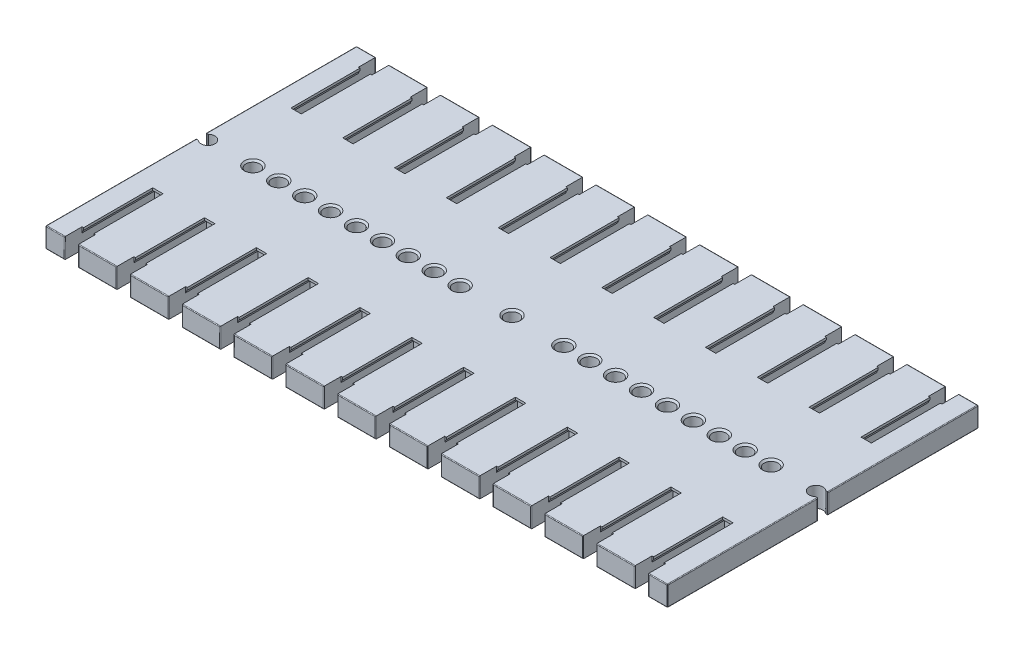
from build123d import *

# Parameters (mm, degrees)
SKETCH_1_W                         = 180
SKETCH_1_H                         = 90
EXTRUDE_1_DEPTH                    = 5.8
CUT_EXTRUDE_1_DEPTH                = 26
SKETCH_3_W                         = 3
SKETCH_3_H                         = 0.677124344
EXTRUDE_2_DEPTH                    = 1
SKETCH_4_W                         = 3.9
SKETCH_4_H                         = 5.8
CUT_EXTRUDE_2_DEPTH                = 5
PATTERN_LINEAR_4_COUNT             = 12
PATTERN_LINEAR_4_PITCH             = 15
PATTERN_LINEAR_4_COPY_1_DEPTH      = 26
PATTERN_LINEAR_4_COPY_2_DEPTH      = 26
PATTERN_LINEAR_4_COPY_3_DEPTH      = 26
PATTERN_LINEAR_4_COPY_4_DEPTH      = 26
PATTERN_LINEAR_4_COPY_5_DEPTH      = 26
PATTERN_LINEAR_4_COPY_6_DEPTH      = 26
PATTERN_LINEAR_4_COPY_7_DEPTH      = 26
PATTERN_LINEAR_4_COPY_8_DEPTH      = 26
PATTERN_LINEAR_4_COPY_9_DEPTH      = 26
PATTERN_LINEAR_4_COPY_10_DEPTH     = 26
PATTERN_LINEAR_4_COPY_11_DEPTH     = 26
PATTERN_LINEAR_4_COPY_12_SKETCH_W  = 3
PATTERN_LINEAR_4_COPY_12_SKETCH_H  = 0.677124344
PATTERN_LINEAR_4_COPY_12_DEPTH     = 1
PATTERN_LINEAR_4_COPY_13_SKETCH_W  = 3
PATTERN_LINEAR_4_COPY_13_SKETCH_H  = 0.677124344
PATTERN_LINEAR_4_COPY_13_DEPTH     = 1
PATTERN_LINEAR_4_COPY_14_SKETCH_W  = 3
PATTERN_LINEAR_4_COPY_14_SKETCH_H  = 0.677124344
PATTERN_LINEAR_4_COPY_14_DEPTH     = 1
PATTERN_LINEAR_4_COPY_15_SKETCH_W  = 3
PATTERN_LINEAR_4_COPY_15_SKETCH_H  = 0.677124344
PATTERN_LINEAR_4_COPY_15_DEPTH     = 1
PATTERN_LINEAR_4_COPY_16_SKETCH_W  = 3
PATTERN_LINEAR_4_COPY_16_SKETCH_H  = 0.677124344
PATTERN_LINEAR_4_COPY_16_DEPTH     = 1
PATTERN_LINEAR_4_COPY_17_SKETCH_W  = 3
PATTERN_LINEAR_4_COPY_17_SKETCH_H  = 0.677124344
PATTERN_LINEAR_4_COPY_17_DEPTH     = 1
PATTERN_LINEAR_4_COPY_18_SKETCH_W  = 3
PATTERN_LINEAR_4_COPY_18_SKETCH_H  = 0.677124344
PATTERN_LINEAR_4_COPY_18_DEPTH     = 1
PATTERN_LINEAR_4_COPY_19_SKETCH_W  = 3
PATTERN_LINEAR_4_COPY_19_SKETCH_H  = 0.677124344
PATTERN_LINEAR_4_COPY_19_DEPTH     = 1
PATTERN_LINEAR_4_COPY_20_SKETCH_W  = 3
PATTERN_LINEAR_4_COPY_20_SKETCH_H  = 0.677124344
PATTERN_LINEAR_4_COPY_20_DEPTH     = 1
PATTERN_LINEAR_4_COPY_21_SKETCH_W  = 3
PATTERN_LINEAR_4_COPY_21_SKETCH_H  = 0.677124344
PATTERN_LINEAR_4_COPY_21_DEPTH     = 1
PATTERN_LINEAR_4_COPY_22_SKETCH_W  = 3
PATTERN_LINEAR_4_COPY_22_SKETCH_H  = 0.677124344
PATTERN_LINEAR_4_COPY_22_DEPTH     = 1
PATTERN_LINEAR_4_COPY_23_SKETCH_W  = 3.9
PATTERN_LINEAR_4_COPY_23_SKETCH_H  = 5.8
PATTERN_LINEAR_4_COPY_23_DEPTH     = 5
PATTERN_LINEAR_4_COPY_24_SKETCH_W  = 3.9
PATTERN_LINEAR_4_COPY_24_SKETCH_H  = 5.8
PATTERN_LINEAR_4_COPY_24_DEPTH     = 5
PATTERN_LINEAR_4_COPY_25_SKETCH_W  = 3.9
PATTERN_LINEAR_4_COPY_25_SKETCH_H  = 5.8
PATTERN_LINEAR_4_COPY_25_DEPTH     = 5
PATTERN_LINEAR_4_COPY_26_SKETCH_W  = 3.9
PATTERN_LINEAR_4_COPY_26_SKETCH_H  = 5.8
PATTERN_LINEAR_4_COPY_26_DEPTH     = 5
PATTERN_LINEAR_4_COPY_27_SKETCH_W  = 3.9
PATTERN_LINEAR_4_COPY_27_SKETCH_H  = 5.8
PATTERN_LINEAR_4_COPY_27_DEPTH     = 5
PATTERN_LINEAR_4_COPY_28_SKETCH_W  = 3.9
PATTERN_LINEAR_4_COPY_28_SKETCH_H  = 5.8
PATTERN_LINEAR_4_COPY_28_DEPTH     = 5
PATTERN_LINEAR_4_COPY_29_SKETCH_W  = 3.9
PATTERN_LINEAR_4_COPY_29_SKETCH_H  = 5.8
PATTERN_LINEAR_4_COPY_29_DEPTH     = 5
PATTERN_LINEAR_4_COPY_30_SKETCH_W  = 3.9
PATTERN_LINEAR_4_COPY_30_SKETCH_H  = 5.8
PATTERN_LINEAR_4_COPY_30_DEPTH     = 5
PATTERN_LINEAR_4_COPY_31_SKETCH_W  = 3.9
PATTERN_LINEAR_4_COPY_31_SKETCH_H  = 5.8
PATTERN_LINEAR_4_COPY_31_DEPTH     = 5
PATTERN_LINEAR_4_COPY_32_SKETCH_W  = 3.9
PATTERN_LINEAR_4_COPY_32_SKETCH_H  = 5.8
PATTERN_LINEAR_4_COPY_32_DEPTH     = 5
PATTERN_LINEAR_4_COPY_33_SKETCH_W  = 3.9
PATTERN_LINEAR_4_COPY_33_SKETCH_H  = 5.8
PATTERN_LINEAR_4_COPY_33_DEPTH     = 5
CUT_EXTRUDE_3_REACH                = 102.79
SKETCH_6_R                         = 2
CHAMFER_1_SIZE                     = 0.5
PATTERN_LINEAR_5_COUNT             = 11
PATTERN_LINEAR_5_PITCH             = 15
CHAMFER_1_OF_PATTERN_LINEAR_5_SIZE = 0.5
CUT_EXTRUDE_4_REACH                = 102.79
SKETCH_7_R                         = 2
CHAMFER_2_SIZE                     = 0.5
PATTERN_LINEAR_7_COUNT             = 4
PATTERN_LINEAR_7_PITCH             = 15
CHAMFER_2_OF_PATTERN_LINEAR_7_SIZE = 0.5
CUT_EXTRUDE_5_REACH                = 102.79
FILLET_4_R                         = 0.2


# Read off the part's stored shape, not the designer's step: 镜向5
with BuildPart() as part:
    # 草图1 → 凸台-拉伸1 (new body)
    with BuildSketch(Plane(origin=(0, 0, 0), x_dir=(1, 0, 0), z_dir=(0, 1, 0))):
        Rectangle(SKETCH_1_W, SKETCH_1_H)
    extrude(amount=EXTRUDE_1_DEPTH)

    # 草图2 → 切除-拉伸1 (cut)
    with BuildSketch(Plane.XY.offset(45)):
        with BuildLine():
            Line((-81, 5.8), (-84, 5.8))
            Line((-84, 5.8), (-84, 5.122875656))
            ThreePointArc((-84, 5.122875656), (-84.280042303, 4.711838473), (-84.45, 4.244409721))
            Line((-84.45, 4.244409721), (-84.45, 1.555590279))
            ThreePointArc((-84.45, 1.555590279), (-84.280042303, 1.088161527), (-84, 0.677124344))
            Line((-84, 0.677124344), (-84, 0))
            Line((-84, 0), (-81, 0))
            Line((-81, 0), (-81, 0.677124344))
            ThreePointArc((-81, 0.677124344), (-80.719957697, 1.088161527), (-80.55, 1.555590279))
            Line((-80.55, 1.555590279), (-80.55, 4.244409721))
            ThreePointArc((-80.55, 4.244409721), (-80.719957697, 4.711838473), (-81, 5.122875656))
            Line((-81, 5.122875656), (-81, 5.8))
        make_face()
    cut_extrude_1 = extrude(amount=-CUT_EXTRUDE_1_DEPTH, mode=Mode.SUBTRACT)

    # 草图3 → 凸台-拉伸2 (add)
    with BuildSketch(Plane.XY.offset(19)):
        with Locations((-82.5, 5.461437828)):
            Rectangle(SKETCH_3_W, SKETCH_3_H)
        with Locations((-82.5, 0.338562172)):
            Rectangle(SKETCH_3_W, SKETCH_3_H)
    extrude_2 = extrude(amount=EXTRUDE_2_DEPTH)

    # 草图4 → 切除-拉伸2 (cut)
    with BuildSketch(Plane.XY.offset(45)):
        with Locations((-82.5, 2.9)):
            Rectangle(SKETCH_4_W, SKETCH_4_H)
    cut_extrude_2 = extrude(amount=-CUT_EXTRUDE_2_DEPTH, mode=Mode.SUBTRACT)

    # 镜向4: 切除-拉伸1, 凸台-拉伸2, 切除-拉伸2 across plane
    add(cut_extrude_1.mirror(Plane.XY), mode=Mode.SUBTRACT)
    add(extrude_2.mirror(Plane.XY))
    add(cut_extrude_2.mirror(Plane.XY), mode=Mode.SUBTRACT)

    # 阵列(线性)4: 切除-拉伸1, 凸台-拉伸2, 切除-拉伸2 ×12
    with Locations(*[(i * PATTERN_LINEAR_4_PITCH, 0, 0) for i in range(1, PATTERN_LINEAR_4_COUNT)]):
        add(cut_extrude_1, mode=Mode.SUBTRACT)
        add(extrude_2)
        add(cut_extrude_2, mode=Mode.SUBTRACT)

    # 阵列(线性)4 copy 1 sketch → 阵列(线性)4 copy 1 (cut)
    with BuildSketch(Plane(origin=(15, 0, -45), x_dir=(1, 0, 0), z_dir=(0, 0, -1))):
        with BuildLine():
            Line((-81, -5.8), (-84, -5.8))
            Line((-84, -5.8), (-84, -5.122875656))
            ThreePointArc((-84, -5.122875656), (-84.280042303, -4.711838473), (-84.45, -4.244409721))
            Line((-84.45, -4.244409721), (-84.45, -1.555590279))
            ThreePointArc((-84.45, -1.555590279), (-84.280042303, -1.088161527), (-84, -0.677124344))
            Line((-84, -0.677124344), (-84, 0))
            Line((-84, 0), (-81, 0))
            Line((-81, 0), (-81, -0.677124344))
            ThreePointArc((-81, -0.677124344), (-80.719957697, -1.088161527), (-80.55, -1.555590279))
            Line((-80.55, -1.555590279), (-80.55, -4.244409721))
            ThreePointArc((-80.55, -4.244409721), (-80.719957697, -4.711838473), (-81, -5.122875656))
            Line((-81, -5.122875656), (-81, -5.8))
        make_face()
    extrude(amount=-PATTERN_LINEAR_4_COPY_1_DEPTH, mode=Mode.SUBTRACT)

    # 阵列(线性)4 copy 2 sketch → 阵列(线性)4 copy 2 (cut)
    with BuildSketch(Plane(origin=(30, 0, -45), x_dir=(1, 0, 0), z_dir=(0, 0, -1))):
        with BuildLine():
            Line((-81, -5.8), (-84, -5.8))
            Line((-84, -5.8), (-84, -5.122875656))
            ThreePointArc((-84, -5.122875656), (-84.280042303, -4.711838473), (-84.45, -4.244409721))
            Line((-84.45, -4.244409721), (-84.45, -1.555590279))
            ThreePointArc((-84.45, -1.555590279), (-84.280042303, -1.088161527), (-84, -0.677124344))
            Line((-84, -0.677124344), (-84, 0))
            Line((-84, 0), (-81, 0))
            Line((-81, 0), (-81, -0.677124344))
            ThreePointArc((-81, -0.677124344), (-80.719957697, -1.088161527), (-80.55, -1.555590279))
            Line((-80.55, -1.555590279), (-80.55, -4.244409721))
            ThreePointArc((-80.55, -4.244409721), (-80.719957697, -4.711838473), (-81, -5.122875656))
            Line((-81, -5.122875656), (-81, -5.8))
        make_face()
    extrude(amount=-PATTERN_LINEAR_4_COPY_2_DEPTH, mode=Mode.SUBTRACT)

    # 阵列(线性)4 copy 3 sketch → 阵列(线性)4 copy 3 (cut)
    with BuildSketch(Plane(origin=(45, 0, -45), x_dir=(1, 0, 0), z_dir=(0, 0, -1))):
        with BuildLine():
            Line((-81, -5.8), (-84, -5.8))
            Line((-84, -5.8), (-84, -5.122875656))
            ThreePointArc((-84, -5.122875656), (-84.280042303, -4.711838473), (-84.45, -4.244409721))
            Line((-84.45, -4.244409721), (-84.45, -1.555590279))
            ThreePointArc((-84.45, -1.555590279), (-84.280042303, -1.088161527), (-84, -0.677124344))
            Line((-84, -0.677124344), (-84, 0))
            Line((-84, 0), (-81, 0))
            Line((-81, 0), (-81, -0.677124344))
            ThreePointArc((-81, -0.677124344), (-80.719957697, -1.088161527), (-80.55, -1.555590279))
            Line((-80.55, -1.555590279), (-80.55, -4.244409721))
            ThreePointArc((-80.55, -4.244409721), (-80.719957697, -4.711838473), (-81, -5.122875656))
            Line((-81, -5.122875656), (-81, -5.8))
        make_face()
    extrude(amount=-PATTERN_LINEAR_4_COPY_3_DEPTH, mode=Mode.SUBTRACT)

    # 阵列(线性)4 copy 4 sketch → 阵列(线性)4 copy 4 (cut)
    with BuildSketch(Plane(origin=(60, 0, -45), x_dir=(1, 0, 0), z_dir=(0, 0, -1))):
        with BuildLine():
            Line((-81, -5.8), (-84, -5.8))
            Line((-84, -5.8), (-84, -5.122875656))
            ThreePointArc((-84, -5.122875656), (-84.280042303, -4.711838473), (-84.45, -4.244409721))
            Line((-84.45, -4.244409721), (-84.45, -1.555590279))
            ThreePointArc((-84.45, -1.555590279), (-84.280042303, -1.088161527), (-84, -0.677124344))
            Line((-84, -0.677124344), (-84, 0))
            Line((-84, 0), (-81, 0))
            Line((-81, 0), (-81, -0.677124344))
            ThreePointArc((-81, -0.677124344), (-80.719957697, -1.088161527), (-80.55, -1.555590279))
            Line((-80.55, -1.555590279), (-80.55, -4.244409721))
            ThreePointArc((-80.55, -4.244409721), (-80.719957697, -4.711838473), (-81, -5.122875656))
            Line((-81, -5.122875656), (-81, -5.8))
        make_face()
    extrude(amount=-PATTERN_LINEAR_4_COPY_4_DEPTH, mode=Mode.SUBTRACT)

    # 阵列(线性)4 copy 5 sketch → 阵列(线性)4 copy 5 (cut)
    with BuildSketch(Plane(origin=(75, 0, -45), x_dir=(1, 0, 0), z_dir=(0, 0, -1))):
        with BuildLine():
            Line((-81, -5.8), (-84, -5.8))
            Line((-84, -5.8), (-84, -5.122875656))
            ThreePointArc((-84, -5.122875656), (-84.280042303, -4.711838473), (-84.45, -4.244409721))
            Line((-84.45, -4.244409721), (-84.45, -1.555590279))
            ThreePointArc((-84.45, -1.555590279), (-84.280042303, -1.088161527), (-84, -0.677124344))
            Line((-84, -0.677124344), (-84, 0))
            Line((-84, 0), (-81, 0))
            Line((-81, 0), (-81, -0.677124344))
            ThreePointArc((-81, -0.677124344), (-80.719957697, -1.088161527), (-80.55, -1.555590279))
            Line((-80.55, -1.555590279), (-80.55, -4.244409721))
            ThreePointArc((-80.55, -4.244409721), (-80.719957697, -4.711838473), (-81, -5.122875656))
            Line((-81, -5.122875656), (-81, -5.8))
        make_face()
    extrude(amount=-PATTERN_LINEAR_4_COPY_5_DEPTH, mode=Mode.SUBTRACT)

    # 阵列(线性)4 copy 6 sketch → 阵列(线性)4 copy 6 (cut)
    with BuildSketch(Plane(origin=(90, 0, -45), x_dir=(1, 0, 0), z_dir=(0, 0, -1))):
        with BuildLine():
            Line((-81, -5.8), (-84, -5.8))
            Line((-84, -5.8), (-84, -5.122875656))
            ThreePointArc((-84, -5.122875656), (-84.280042303, -4.711838473), (-84.45, -4.244409721))
            Line((-84.45, -4.244409721), (-84.45, -1.555590279))
            ThreePointArc((-84.45, -1.555590279), (-84.280042303, -1.088161527), (-84, -0.677124344))
            Line((-84, -0.677124344), (-84, 0))
            Line((-84, 0), (-81, 0))
            Line((-81, 0), (-81, -0.677124344))
            ThreePointArc((-81, -0.677124344), (-80.719957697, -1.088161527), (-80.55, -1.555590279))
            Line((-80.55, -1.555590279), (-80.55, -4.244409721))
            ThreePointArc((-80.55, -4.244409721), (-80.719957697, -4.711838473), (-81, -5.122875656))
            Line((-81, -5.122875656), (-81, -5.8))
        make_face()
    extrude(amount=-PATTERN_LINEAR_4_COPY_6_DEPTH, mode=Mode.SUBTRACT)

    # 阵列(线性)4 copy 7 sketch → 阵列(线性)4 copy 7 (cut)
    with BuildSketch(Plane(origin=(105, 0, -45), x_dir=(1, 0, 0), z_dir=(0, 0, -1))):
        with BuildLine():
            Line((-81, -5.8), (-84, -5.8))
            Line((-84, -5.8), (-84, -5.122875656))
            ThreePointArc((-84, -5.122875656), (-84.280042303, -4.711838473), (-84.45, -4.244409721))
            Line((-84.45, -4.244409721), (-84.45, -1.555590279))
            ThreePointArc((-84.45, -1.555590279), (-84.280042303, -1.088161527), (-84, -0.677124344))
            Line((-84, -0.677124344), (-84, 0))
            Line((-84, 0), (-81, 0))
            Line((-81, 0), (-81, -0.677124344))
            ThreePointArc((-81, -0.677124344), (-80.719957697, -1.088161527), (-80.55, -1.555590279))
            Line((-80.55, -1.555590279), (-80.55, -4.244409721))
            ThreePointArc((-80.55, -4.244409721), (-80.719957697, -4.711838473), (-81, -5.122875656))
            Line((-81, -5.122875656), (-81, -5.8))
        make_face()
    extrude(amount=-PATTERN_LINEAR_4_COPY_7_DEPTH, mode=Mode.SUBTRACT)

    # 阵列(线性)4 copy 8 sketch → 阵列(线性)4 copy 8 (cut)
    with BuildSketch(Plane(origin=(120, 0, -45), x_dir=(1, 0, 0), z_dir=(0, 0, -1))):
        with BuildLine():
            Line((-81, -5.8), (-84, -5.8))
            Line((-84, -5.8), (-84, -5.122875656))
            ThreePointArc((-84, -5.122875656), (-84.280042303, -4.711838473), (-84.45, -4.244409721))
            Line((-84.45, -4.244409721), (-84.45, -1.555590279))
            ThreePointArc((-84.45, -1.555590279), (-84.280042303, -1.088161527), (-84, -0.677124344))
            Line((-84, -0.677124344), (-84, 0))
            Line((-84, 0), (-81, 0))
            Line((-81, 0), (-81, -0.677124344))
            ThreePointArc((-81, -0.677124344), (-80.719957697, -1.088161527), (-80.55, -1.555590279))
            Line((-80.55, -1.555590279), (-80.55, -4.244409721))
            ThreePointArc((-80.55, -4.244409721), (-80.719957697, -4.711838473), (-81, -5.122875656))
            Line((-81, -5.122875656), (-81, -5.8))
        make_face()
    extrude(amount=-PATTERN_LINEAR_4_COPY_8_DEPTH, mode=Mode.SUBTRACT)

    # 阵列(线性)4 copy 9 sketch → 阵列(线性)4 copy 9 (cut)
    with BuildSketch(Plane(origin=(135, 0, -45), x_dir=(1, 0, 0), z_dir=(0, 0, -1))):
        with BuildLine():
            Line((-81, -5.8), (-84, -5.8))
            Line((-84, -5.8), (-84, -5.122875656))
            ThreePointArc((-84, -5.122875656), (-84.280042303, -4.711838473), (-84.45, -4.244409721))
            Line((-84.45, -4.244409721), (-84.45, -1.555590279))
            ThreePointArc((-84.45, -1.555590279), (-84.280042303, -1.088161527), (-84, -0.677124344))
            Line((-84, -0.677124344), (-84, 0))
            Line((-84, 0), (-81, 0))
            Line((-81, 0), (-81, -0.677124344))
            ThreePointArc((-81, -0.677124344), (-80.719957697, -1.088161527), (-80.55, -1.555590279))
            Line((-80.55, -1.555590279), (-80.55, -4.244409721))
            ThreePointArc((-80.55, -4.244409721), (-80.719957697, -4.711838473), (-81, -5.122875656))
            Line((-81, -5.122875656), (-81, -5.8))
        make_face()
    extrude(amount=-PATTERN_LINEAR_4_COPY_9_DEPTH, mode=Mode.SUBTRACT)

    # 阵列(线性)4 copy 10 sketch → 阵列(线性)4 copy 10 (cut)
    with BuildSketch(Plane(origin=(150, 0, -45), x_dir=(1, 0, 0), z_dir=(0, 0, -1))):
        with BuildLine():
            Line((-81, -5.8), (-84, -5.8))
            Line((-84, -5.8), (-84, -5.122875656))
            ThreePointArc((-84, -5.122875656), (-84.280042303, -4.711838473), (-84.45, -4.244409721))
            Line((-84.45, -4.244409721), (-84.45, -1.555590279))
            ThreePointArc((-84.45, -1.555590279), (-84.280042303, -1.088161527), (-84, -0.677124344))
            Line((-84, -0.677124344), (-84, 0))
            Line((-84, 0), (-81, 0))
            Line((-81, 0), (-81, -0.677124344))
            ThreePointArc((-81, -0.677124344), (-80.719957697, -1.088161527), (-80.55, -1.555590279))
            Line((-80.55, -1.555590279), (-80.55, -4.244409721))
            ThreePointArc((-80.55, -4.244409721), (-80.719957697, -4.711838473), (-81, -5.122875656))
            Line((-81, -5.122875656), (-81, -5.8))
        make_face()
    extrude(amount=-PATTERN_LINEAR_4_COPY_10_DEPTH, mode=Mode.SUBTRACT)

    # 阵列(线性)4 copy 11 sketch → 阵列(线性)4 copy 11 (cut)
    with BuildSketch(Plane(origin=(165, 0, -45), x_dir=(1, 0, 0), z_dir=(0, 0, -1))):
        with BuildLine():
            Line((-81, -5.8), (-84, -5.8))
            Line((-84, -5.8), (-84, -5.122875656))
            ThreePointArc((-84, -5.122875656), (-84.280042303, -4.711838473), (-84.45, -4.244409721))
            Line((-84.45, -4.244409721), (-84.45, -1.555590279))
            ThreePointArc((-84.45, -1.555590279), (-84.280042303, -1.088161527), (-84, -0.677124344))
            Line((-84, -0.677124344), (-84, 0))
            Line((-84, 0), (-81, 0))
            Line((-81, 0), (-81, -0.677124344))
            ThreePointArc((-81, -0.677124344), (-80.719957697, -1.088161527), (-80.55, -1.555590279))
            Line((-80.55, -1.555590279), (-80.55, -4.244409721))
            ThreePointArc((-80.55, -4.244409721), (-80.719957697, -4.711838473), (-81, -5.122875656))
            Line((-81, -5.122875656), (-81, -5.8))
        make_face()
    extrude(amount=-PATTERN_LINEAR_4_COPY_11_DEPTH, mode=Mode.SUBTRACT)

    # 阵列(线性)4 copy 12 sketch → 阵列(线性)4 copy 12 (add)
    with BuildSketch(Plane(origin=(15, 0, -19), x_dir=(1, 0, 0), z_dir=(0, 0, -1))):
        with Locations((-82.5, -5.461437828)):
            Rectangle(PATTERN_LINEAR_4_COPY_12_SKETCH_W, PATTERN_LINEAR_4_COPY_12_SKETCH_H)
        with Locations((-82.5, -0.338562172)):
            Rectangle(PATTERN_LINEAR_4_COPY_12_SKETCH_W, PATTERN_LINEAR_4_COPY_12_SKETCH_H)
    extrude(amount=PATTERN_LINEAR_4_COPY_12_DEPTH)

    # 阵列(线性)4 copy 13 sketch → 阵列(线性)4 copy 13 (add)
    with BuildSketch(Plane(origin=(30, 0, -19), x_dir=(1, 0, 0), z_dir=(0, 0, -1))):
        with Locations((-82.5, -5.461437828)):
            Rectangle(PATTERN_LINEAR_4_COPY_13_SKETCH_W, PATTERN_LINEAR_4_COPY_13_SKETCH_H)
        with Locations((-82.5, -0.338562172)):
            Rectangle(PATTERN_LINEAR_4_COPY_13_SKETCH_W, PATTERN_LINEAR_4_COPY_13_SKETCH_H)
    extrude(amount=PATTERN_LINEAR_4_COPY_13_DEPTH)

    # 阵列(线性)4 copy 14 sketch → 阵列(线性)4 copy 14 (add)
    with BuildSketch(Plane(origin=(45, 0, -19), x_dir=(1, 0, 0), z_dir=(0, 0, -1))):
        with Locations((-82.5, -5.461437828)):
            Rectangle(PATTERN_LINEAR_4_COPY_14_SKETCH_W, PATTERN_LINEAR_4_COPY_14_SKETCH_H)
        with Locations((-82.5, -0.338562172)):
            Rectangle(PATTERN_LINEAR_4_COPY_14_SKETCH_W, PATTERN_LINEAR_4_COPY_14_SKETCH_H)
    extrude(amount=PATTERN_LINEAR_4_COPY_14_DEPTH)

    # 阵列(线性)4 copy 15 sketch → 阵列(线性)4 copy 15 (add)
    with BuildSketch(Plane(origin=(60, 0, -19), x_dir=(1, 0, 0), z_dir=(0, 0, -1))):
        with Locations((-82.5, -5.461437828)):
            Rectangle(PATTERN_LINEAR_4_COPY_15_SKETCH_W, PATTERN_LINEAR_4_COPY_15_SKETCH_H)
        with Locations((-82.5, -0.338562172)):
            Rectangle(PATTERN_LINEAR_4_COPY_15_SKETCH_W, PATTERN_LINEAR_4_COPY_15_SKETCH_H)
    extrude(amount=PATTERN_LINEAR_4_COPY_15_DEPTH)

    # 阵列(线性)4 copy 16 sketch → 阵列(线性)4 copy 16 (add)
    with BuildSketch(Plane(origin=(75, 0, -19), x_dir=(1, 0, 0), z_dir=(0, 0, -1))):
        with Locations((-82.5, -5.461437828)):
            Rectangle(PATTERN_LINEAR_4_COPY_16_SKETCH_W, PATTERN_LINEAR_4_COPY_16_SKETCH_H)
        with Locations((-82.5, -0.338562172)):
            Rectangle(PATTERN_LINEAR_4_COPY_16_SKETCH_W, PATTERN_LINEAR_4_COPY_16_SKETCH_H)
    extrude(amount=PATTERN_LINEAR_4_COPY_16_DEPTH)

    # 阵列(线性)4 copy 17 sketch → 阵列(线性)4 copy 17 (add)
    with BuildSketch(Plane(origin=(90, 0, -19), x_dir=(1, 0, 0), z_dir=(0, 0, -1))):
        with Locations((-82.5, -5.461437828)):
            Rectangle(PATTERN_LINEAR_4_COPY_17_SKETCH_W, PATTERN_LINEAR_4_COPY_17_SKETCH_H)
        with Locations((-82.5, -0.338562172)):
            Rectangle(PATTERN_LINEAR_4_COPY_17_SKETCH_W, PATTERN_LINEAR_4_COPY_17_SKETCH_H)
    extrude(amount=PATTERN_LINEAR_4_COPY_17_DEPTH)

    # 阵列(线性)4 copy 18 sketch → 阵列(线性)4 copy 18 (add)
    with BuildSketch(Plane(origin=(105, 0, -19), x_dir=(1, 0, 0), z_dir=(0, 0, -1))):
        with Locations((-82.5, -5.461437828)):
            Rectangle(PATTERN_LINEAR_4_COPY_18_SKETCH_W, PATTERN_LINEAR_4_COPY_18_SKETCH_H)
        with Locations((-82.5, -0.338562172)):
            Rectangle(PATTERN_LINEAR_4_COPY_18_SKETCH_W, PATTERN_LINEAR_4_COPY_18_SKETCH_H)
    extrude(amount=PATTERN_LINEAR_4_COPY_18_DEPTH)

    # 阵列(线性)4 copy 19 sketch → 阵列(线性)4 copy 19 (add)
    with BuildSketch(Plane(origin=(120, 0, -19), x_dir=(1, 0, 0), z_dir=(0, 0, -1))):
        with Locations((-82.5, -5.461437828)):
            Rectangle(PATTERN_LINEAR_4_COPY_19_SKETCH_W, PATTERN_LINEAR_4_COPY_19_SKETCH_H)
        with Locations((-82.5, -0.338562172)):
            Rectangle(PATTERN_LINEAR_4_COPY_19_SKETCH_W, PATTERN_LINEAR_4_COPY_19_SKETCH_H)
    extrude(amount=PATTERN_LINEAR_4_COPY_19_DEPTH)

    # 阵列(线性)4 copy 20 sketch → 阵列(线性)4 copy 20 (add)
    with BuildSketch(Plane(origin=(135, 0, -19), x_dir=(1, 0, 0), z_dir=(0, 0, -1))):
        with Locations((-82.5, -5.461437828)):
            Rectangle(PATTERN_LINEAR_4_COPY_20_SKETCH_W, PATTERN_LINEAR_4_COPY_20_SKETCH_H)
        with Locations((-82.5, -0.338562172)):
            Rectangle(PATTERN_LINEAR_4_COPY_20_SKETCH_W, PATTERN_LINEAR_4_COPY_20_SKETCH_H)
    extrude(amount=PATTERN_LINEAR_4_COPY_20_DEPTH)

    # 阵列(线性)4 copy 21 sketch → 阵列(线性)4 copy 21 (add)
    with BuildSketch(Plane(origin=(150, 0, -19), x_dir=(1, 0, 0), z_dir=(0, 0, -1))):
        with Locations((-82.5, -5.461437828)):
            Rectangle(PATTERN_LINEAR_4_COPY_21_SKETCH_W, PATTERN_LINEAR_4_COPY_21_SKETCH_H)
        with Locations((-82.5, -0.338562172)):
            Rectangle(PATTERN_LINEAR_4_COPY_21_SKETCH_W, PATTERN_LINEAR_4_COPY_21_SKETCH_H)
    extrude(amount=PATTERN_LINEAR_4_COPY_21_DEPTH)

    # 阵列(线性)4 copy 22 sketch → 阵列(线性)4 copy 22 (add)
    with BuildSketch(Plane(origin=(165, 0, -19), x_dir=(1, 0, 0), z_dir=(0, 0, -1))):
        with Locations((-82.5, -5.461437828)):
            Rectangle(PATTERN_LINEAR_4_COPY_22_SKETCH_W, PATTERN_LINEAR_4_COPY_22_SKETCH_H)
        with Locations((-82.5, -0.338562172)):
            Rectangle(PATTERN_LINEAR_4_COPY_22_SKETCH_W, PATTERN_LINEAR_4_COPY_22_SKETCH_H)
    extrude(amount=PATTERN_LINEAR_4_COPY_22_DEPTH)

    # 阵列(线性)4 copy 23 sketch → 阵列(线性)4 copy 23 (cut)
    with BuildSketch(Plane(origin=(15, 0, -45), x_dir=(1, 0, 0), z_dir=(0, 0, -1))):
        with Locations((-82.5, -2.9)):
            Rectangle(PATTERN_LINEAR_4_COPY_23_SKETCH_W, PATTERN_LINEAR_4_COPY_23_SKETCH_H)
    extrude(amount=-PATTERN_LINEAR_4_COPY_23_DEPTH, mode=Mode.SUBTRACT)

    # 阵列(线性)4 copy 24 sketch → 阵列(线性)4 copy 24 (cut)
    with BuildSketch(Plane(origin=(30, 0, -45), x_dir=(1, 0, 0), z_dir=(0, 0, -1))):
        with Locations((-82.5, -2.9)):
            Rectangle(PATTERN_LINEAR_4_COPY_24_SKETCH_W, PATTERN_LINEAR_4_COPY_24_SKETCH_H)
    extrude(amount=-PATTERN_LINEAR_4_COPY_24_DEPTH, mode=Mode.SUBTRACT)

    # 阵列(线性)4 copy 25 sketch → 阵列(线性)4 copy 25 (cut)
    with BuildSketch(Plane(origin=(45, 0, -45), x_dir=(1, 0, 0), z_dir=(0, 0, -1))):
        with Locations((-82.5, -2.9)):
            Rectangle(PATTERN_LINEAR_4_COPY_25_SKETCH_W, PATTERN_LINEAR_4_COPY_25_SKETCH_H)
    extrude(amount=-PATTERN_LINEAR_4_COPY_25_DEPTH, mode=Mode.SUBTRACT)

    # 阵列(线性)4 copy 26 sketch → 阵列(线性)4 copy 26 (cut)
    with BuildSketch(Plane(origin=(60, 0, -45), x_dir=(1, 0, 0), z_dir=(0, 0, -1))):
        with Locations((-82.5, -2.9)):
            Rectangle(PATTERN_LINEAR_4_COPY_26_SKETCH_W, PATTERN_LINEAR_4_COPY_26_SKETCH_H)
    extrude(amount=-PATTERN_LINEAR_4_COPY_26_DEPTH, mode=Mode.SUBTRACT)

    # 阵列(线性)4 copy 27 sketch → 阵列(线性)4 copy 27 (cut)
    with BuildSketch(Plane(origin=(75, 0, -45), x_dir=(1, 0, 0), z_dir=(0, 0, -1))):
        with Locations((-82.5, -2.9)):
            Rectangle(PATTERN_LINEAR_4_COPY_27_SKETCH_W, PATTERN_LINEAR_4_COPY_27_SKETCH_H)
    extrude(amount=-PATTERN_LINEAR_4_COPY_27_DEPTH, mode=Mode.SUBTRACT)

    # 阵列(线性)4 copy 28 sketch → 阵列(线性)4 copy 28 (cut)
    with BuildSketch(Plane(origin=(90, 0, -45), x_dir=(1, 0, 0), z_dir=(0, 0, -1))):
        with Locations((-82.5, -2.9)):
            Rectangle(PATTERN_LINEAR_4_COPY_28_SKETCH_W, PATTERN_LINEAR_4_COPY_28_SKETCH_H)
    extrude(amount=-PATTERN_LINEAR_4_COPY_28_DEPTH, mode=Mode.SUBTRACT)

    # 阵列(线性)4 copy 29 sketch → 阵列(线性)4 copy 29 (cut)
    with BuildSketch(Plane(origin=(105, 0, -45), x_dir=(1, 0, 0), z_dir=(0, 0, -1))):
        with Locations((-82.5, -2.9)):
            Rectangle(PATTERN_LINEAR_4_COPY_29_SKETCH_W, PATTERN_LINEAR_4_COPY_29_SKETCH_H)
    extrude(amount=-PATTERN_LINEAR_4_COPY_29_DEPTH, mode=Mode.SUBTRACT)

    # 阵列(线性)4 copy 30 sketch → 阵列(线性)4 copy 30 (cut)
    with BuildSketch(Plane(origin=(120, 0, -45), x_dir=(1, 0, 0), z_dir=(0, 0, -1))):
        with Locations((-82.5, -2.9)):
            Rectangle(PATTERN_LINEAR_4_COPY_30_SKETCH_W, PATTERN_LINEAR_4_COPY_30_SKETCH_H)
    extrude(amount=-PATTERN_LINEAR_4_COPY_30_DEPTH, mode=Mode.SUBTRACT)

    # 阵列(线性)4 copy 31 sketch → 阵列(线性)4 copy 31 (cut)
    with BuildSketch(Plane(origin=(135, 0, -45), x_dir=(1, 0, 0), z_dir=(0, 0, -1))):
        with Locations((-82.5, -2.9)):
            Rectangle(PATTERN_LINEAR_4_COPY_31_SKETCH_W, PATTERN_LINEAR_4_COPY_31_SKETCH_H)
    extrude(amount=-PATTERN_LINEAR_4_COPY_31_DEPTH, mode=Mode.SUBTRACT)

    # 阵列(线性)4 copy 32 sketch → 阵列(线性)4 copy 32 (cut)
    with BuildSketch(Plane(origin=(150, 0, -45), x_dir=(1, 0, 0), z_dir=(0, 0, -1))):
        with Locations((-82.5, -2.9)):
            Rectangle(PATTERN_LINEAR_4_COPY_32_SKETCH_W, PATTERN_LINEAR_4_COPY_32_SKETCH_H)
    extrude(amount=-PATTERN_LINEAR_4_COPY_32_DEPTH, mode=Mode.SUBTRACT)

    # 阵列(线性)4 copy 33 sketch → 阵列(线性)4 copy 33 (cut)
    with BuildSketch(Plane(origin=(165, 0, -45), x_dir=(1, 0, 0), z_dir=(0, 0, -1))):
        with Locations((-82.5, -2.9)):
            Rectangle(PATTERN_LINEAR_4_COPY_33_SKETCH_W, PATTERN_LINEAR_4_COPY_33_SKETCH_H)
    extrude(amount=-PATTERN_LINEAR_4_COPY_33_DEPTH, mode=Mode.SUBTRACT)

    # 草图6 → 切除-拉伸3 (cut, up to next)
    with BuildSketch(Plane.XZ, mode=Mode.PRIVATE) as cut_extrude_3_sk1:
        with Locations(Location((-75, 0, 0), (0, 0, 270))):
            Circle(SKETCH_6_R)
    cut_extrude_3_tool1 = extrude(cut_extrude_3_sk1.sketch, amount=-CUT_EXTRUDE_3_REACH, mode=Mode.PRIVATE) & part.part
    cut_extrude_3 = cut_extrude_3_tool1.solids().sort_by_distance((-75, 0, 0))[0]
    add(cut_extrude_3, mode=Mode.SUBTRACT)

    # 倒角1
    chamfer_1_edges = [part.edges().sort_by_distance(p)[0] for p in [
        (-75, 5.8, 2),
        (-75, 0, 2),
    ]]
    chamfer(chamfer_1_edges, length=CHAMFER_1_SIZE)

    # 阵列(线性)5: 切除-拉伸3 ×11
    with Locations(*[(i * PATTERN_LINEAR_5_PITCH, 0, 0) for i in range(1, PATTERN_LINEAR_5_COUNT)]):
        add(cut_extrude_3, mode=Mode.SUBTRACT)

    # 倒角1 of 阵列(线性)5
    chamfer_1_of_pattern_linear_5_edges = [part.edges().sort_by_distance(p)[0] for p in [
        (-60, 5.8, 2),
        (-60, 0, 2),
        (-45, 5.8, 2),
        (-45, 0, 2),
        (-30, 5.8, 2),
        (-30, 0, 2),
        (-15, 5.8, 2),
        (-15, 0, 2),
        (0, 5.8, 2),
        (0, 0, 2),
        (15, 5.8, 2),
        (15, 0, 2),
        (30, 5.8, 2),
        (30, 0, 2),
        (45, 5.8, 2),
        (45, 0, 2),
        (60, 5.8, 2),
        (60, 0, 2),
        (75, 5.8, 2),
        (75, 0, 2),
    ]]
    chamfer(chamfer_1_of_pattern_linear_5_edges, length=CHAMFER_1_OF_PATTERN_LINEAR_5_SIZE)

    # 草图7 → 切除-拉伸4 (cut, up to next)
    with BuildSketch(Plane.XZ, mode=Mode.PRIVATE) as cut_extrude_4_sk1:
        with Locations(Location((-67.5, 0, 0), (0, 0, 270))):
            Circle(SKETCH_7_R)
    cut_extrude_4_tool1 = extrude(cut_extrude_4_sk1.sketch, amount=-CUT_EXTRUDE_4_REACH, mode=Mode.PRIVATE) & part.part
    cut_extrude_4 = cut_extrude_4_tool1.solids().sort_by_distance((-67.5, 0, 0))[0]
    add(cut_extrude_4, mode=Mode.SUBTRACT)

    # 倒角2
    chamfer_2_edges = [part.edges().sort_by_distance(p)[0] for p in [
        (-67.5, 5.8, 2),
        (-67.5, 0, 2),
    ]]
    chamfer(chamfer_2_edges, length=CHAMFER_2_SIZE)

    # 阵列(线性)7: 切除-拉伸4 ×4
    with Locations(*[(i * PATTERN_LINEAR_7_PITCH, 0, 0) for i in range(1, PATTERN_LINEAR_7_COUNT)]):
        add(cut_extrude_4, mode=Mode.SUBTRACT)

    # 倒角2 of 阵列(线性)7
    chamfer_2_of_pattern_linear_7_edges = [part.edges().sort_by_distance(p)[0] for p in [
        (-52.5, 5.8, 2),
        (-52.5, 0, 2),
        (-37.5, 5.8, 2),
        (-37.5, 0, 2),
        (-22.5, 5.8, 2),
        (-22.5, 0, 2),
    ]]
    chamfer(chamfer_2_of_pattern_linear_7_edges, length=CHAMFER_2_OF_PATTERN_LINEAR_7_SIZE)

    # 镜向5 outline → 镜向5 (revolve, cut)
    with BuildSketch(Plane(origin=(67.5, 0, 0), x_dir=(1, 0, 0), z_dir=(0, 0, 1))):
        Polygon((2.5, 5.8), (0, 5.8), (0, 0), (2.5, 0), (2, 0.5), (2, 5.3), align=None)
    revolve(axis=Axis((67.5, 0, 0), (0, 1, 0)), mode=Mode.SUBTRACT)

    # Mirror 5 2 outline → Mirror 5 2 (revolve, cut)
    with BuildSketch(Plane(origin=(52.5, 0, 0), x_dir=(1, 0, 0), z_dir=(0, 0, 1))):
        Polygon((2.5, 5.8), (0, 5.8), (0, 0), (2.5, 0), (2, 0.5), (2, 5.3), align=None)
    revolve(axis=Axis((52.5, 0, 0), (0, 1, 0)), mode=Mode.SUBTRACT)

    # Mirror 5 3 outline → Mirror 5 3 (revolve, cut)
    with BuildSketch(Plane(origin=(37.5, 0, 0), x_dir=(1, 0, 0), z_dir=(0, 0, 1))):
        Polygon((2.5, 5.8), (0, 5.8), (0, 0), (2.5, 0), (2, 0.5), (2, 5.3), align=None)
    revolve(axis=Axis((37.5, 0, 0), (0, 1, 0)), mode=Mode.SUBTRACT)

    # Mirror 5 4 outline → Mirror 5 4 (revolve, cut)
    with BuildSketch(Plane(origin=(22.5, 0, 0), x_dir=(1, 0, 0), z_dir=(0, 0, 1))):
        Polygon((2.5, 5.8), (0, 5.8), (0, 0), (2.5, 0), (2, 0.5), (2, 5.3), align=None)
    revolve(axis=Axis((22.5, 0, 0), (0, 1, 0)), mode=Mode.SUBTRACT)

    # 草图8 → 切除-拉伸5 (cut, up to next)
    with BuildSketch(Plane.XZ, mode=Mode.PRIVATE) as cut_extrude_5_sk1:
        with BuildLine():
            Line((-90, -1.5), (-90, 1.5))
            Line((-90, 1.5), (-89.322875656, 1.5))
            ThreePointArc((-89.322875656, 1.5), (-86, 0), (-89.322875656, -1.5))
            Line((-89.322875656, -1.5), (-90, -1.5))
        make_face()
    cut_extrude_5_tool1 = extrude(cut_extrude_5_sk1.sketch, amount=-CUT_EXTRUDE_5_REACH, mode=Mode.PRIVATE) & part.part
    cut_extrude_5 = cut_extrude_5_tool1.solids().sort_by_distance((-88.085293, 0, 0))[0]
    add(cut_extrude_5, mode=Mode.SUBTRACT)

    # 镜向6: 切除-拉伸5 across plane
    add(cut_extrude_5.mirror(Plane(origin=(0, 0, 0), x_dir=(0, 0, 1), z_dir=(1, 0, 0))), mode=Mode.SUBTRACT)

    # 圆角4
    fillet_4_edges = [part.edges().sort_by_distance(p)[0] for p in [
        (-87.225, 5.8, 45),
        (30, 0, -45),
        (30, 5.8, -45),
        (50.55, 2.9, -45),
        (54.45, 2.9, -45),
        (45, 0, -45),
        (45, 5.8, -45),
        (65.55, 2.9, -45),
        (69.45, 2.9, -45),
        (60, 0, -45),
        (60, 5.8, -45),
        (90, 5.8, 23.25),
        (80.55, 2.9, -45),
        (84.45, 2.9, -45),
        (-84.45, 2.9, -45),
        (75, 0, -45),
        (75, 5.8, -45),
        (-80.55, 2.9, -45),
        (-69.45, 2.9, 45),
        (-65.55, 2.9, 45),
        (-54.45, 2.9, 45),
        (-50.55, 2.9, 45),
        (-39.45, 2.9, 45),
        (-35.55, 2.9, 45),
        (-24.45, 2.9, 45),
        (-20.55, 2.9, 45),
        (-9.45, 2.9, 45),
        (-5.55, 2.9, 45),
        (5.55, 2.9, 45),
        (9.45, 2.9, 45),
        (20.55, 2.9, 45),
        (24.45, 2.9, 45),
        (35.55, 2.9, 45),
        (39.45, 2.9, 45),
        (50.55, 2.9, 45),
        (54.45, 2.9, 45),
        (65.55, 2.9, 45),
        (69.45, 2.9, 45),
        (80.55, 2.9, 45),
        (84.45, 2.9, 45),
        (-87.225, 0, -45),
        (-87.225, 5.8, -45),
        (-60, 0, 45),
        (-60, 5.8, 45),
        (-45, 0, 45),
        (-45, 5.8, 45),
        (-30, 0, 45),
        (-30, 5.8, 45),
        (-15, 0, 45),
        (-15, 5.8, 45),
        (0, 0, 45),
        (0, 5.8, 45),
        (15, 0, 45),
        (15, 5.8, 45),
        (30, 0, 45),
        (30, 5.8, 45),
        (45, 0, 45),
        (45, 5.8, 45),
        (-69.45, 2.9, -45),
        (60, 0, 45),
        (60, 5.8, 45),
        (-65.55, 2.9, -45),
        (75, 0, 45),
        (75, 5.8, 45),
        (87.225, 0, 45),
        (87.225, 5.8, 45),
        (-84.45, 2.9, 45),
        (-90, 0, 23.25),
        (-90, 5.8, 23.25),
        (-90, 2.9, -1.5),
        (-90, 2.9, 1.5),
        (90, 0, -23.25),
        (90, 5.8, -23.25),
        (90, 2.9, -1.5),
        (90, 2.9, 1.5),
        (-80.55, 2.9, 45),
        (-75, 0, -45),
        (-75, 5.8, -45),
        (-54.45, 2.9, -45),
        (-50.55, 2.9, -45),
        (87.225, 5.8, -45),
        (-60, 0, -45),
        (-60, 5.8, -45),
        (90, 0, 23.25),
        (-39.45, 2.9, -45),
        (-35.55, 2.9, -45),
        (-87.225, 0, 45),
        (-45, 0, -45),
        (-45, 5.8, -45),
        (-90, 0, -23.25),
        (-24.45, 2.9, -45),
        (-20.55, 2.9, -45),
        (87.225, 0, -45),
        (-30, 0, -45),
        (-30, 5.8, -45),
        (-9.45, 2.9, -45),
        (-5.55, 2.9, -45),
        (-90, 5.8, -23.25),
        (-15, 0, -45),
        (-15, 5.8, -45),
        (90, 2.9, -45),
        (90, 2.9, 45),
        (-90, 2.9, 45),
        (-90, 2.9, -45),
        (5.55, 2.9, -45),
        (9.45, 2.9, -45),
        (0, 0, -45),
        (0, 5.8, -45),
        (-75, 0, 45),
        (-75, 5.8, 45),
        (20.55, 2.9, -45),
        (24.45, 2.9, -45),
        (15, 0, -45),
        (15, 5.8, -45),
        (35.55, 2.9, -45),
        (39.45, 2.9, -45),
    ]]
    fillet(fillet_4_edges, radius=FILLET_4_R)


solid = part.part
